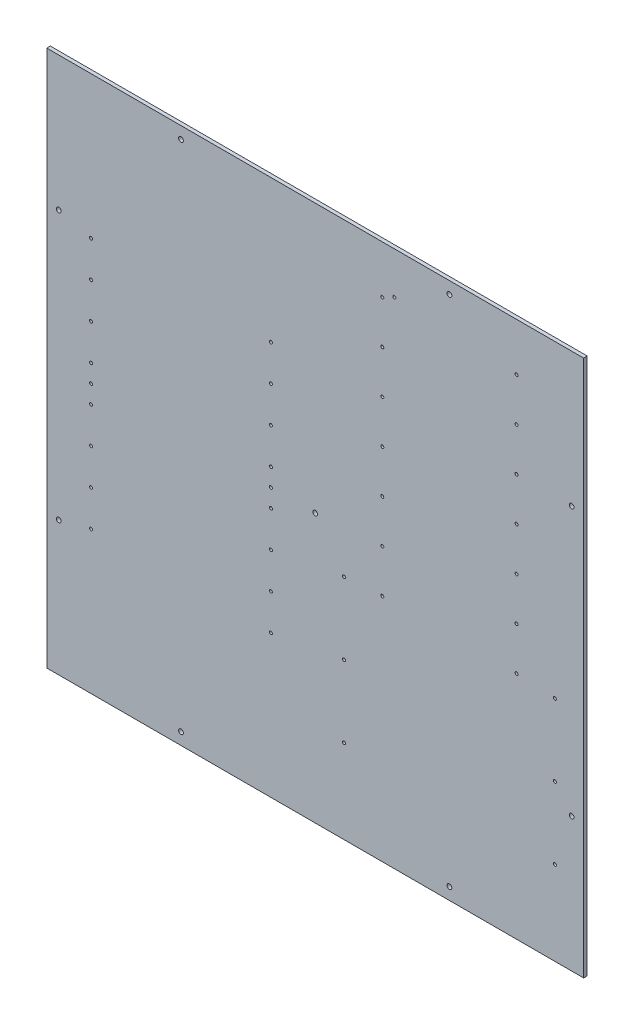
from build123d import *

# Parameters (mm, degrees)
SCHIZZO1_W                   = 448
SCHIZZO1_H                   = 448
SCHIZZO1_R                   = 2
SCHIZZO1_R_2                 = 1.25
ESTRUSIONE_ESTRUSIONE1_DEPTH = 3


with BuildPart() as part:
    # Schizzo1 → Estrusione-Estrusione1 (new body)
    with BuildSketch(Plane.XY):
        with Locations((224, 224)):
            Rectangle(SCHIZZO1_W, SCHIZZO1_H)
        with Locations((10, 336)):
            Circle(SCHIZZO1_R, mode=Mode.SUBTRACT)
        with Locations((336, 438)):
            Circle(SCHIZZO1_R, mode=Mode.SUBTRACT)
        with Locations((438, 336)):
            Circle(SCHIZZO1_R, mode=Mode.SUBTRACT)
        with Locations((438, 112)):
            Circle(SCHIZZO1_R, mode=Mode.SUBTRACT)
        with Locations((336, 10)):
            Circle(SCHIZZO1_R, mode=Mode.SUBTRACT)
        with Locations((112, 10)):
            Circle(SCHIZZO1_R, mode=Mode.SUBTRACT)
        with Locations((10, 112)):
            Circle(SCHIZZO1_R, mode=Mode.SUBTRACT)
        with Locations((36.958788995, 224)):
            Circle(SCHIZZO1_R_2, mode=Mode.SUBTRACT)
        with Locations((112, 438)):
            Circle(SCHIZZO1_R, mode=Mode.SUBTRACT)
        with Locations((36.958788995, 239)):
            Circle(SCHIZZO1_R_2, mode=Mode.SUBTRACT)
        with Locations((36.958788995, 269)):
            Circle(SCHIZZO1_R_2, mode=Mode.SUBTRACT)
        with Locations((36.958788995, 299)):
            Circle(SCHIZZO1_R_2, mode=Mode.SUBTRACT)
        with Locations((36.958788995, 329)):
            Circle(SCHIZZO1_R_2, mode=Mode.SUBTRACT)
        with Locations((248, 70)):
            Circle(SCHIZZO1_R_2, mode=Mode.SUBTRACT)
        with Locations((248, 130)):
            Circle(SCHIZZO1_R_2, mode=Mode.SUBTRACT)
        with Locations((424, 130)):
            Circle(SCHIZZO1_R_2, mode=Mode.SUBTRACT)
        with Locations((424, 70)):
            Circle(SCHIZZO1_R_2, mode=Mode.SUBTRACT)
        with Locations((290, 413)):
            Circle(SCHIZZO1_R_2, mode=Mode.SUBTRACT)
        with Locations((280, 408)):
            Circle(SCHIZZO1_R_2, mode=Mode.SUBTRACT)
        with Locations((392, 408)):
            Circle(SCHIZZO1_R_2, mode=Mode.SUBTRACT)
        with Locations((280, 372)):
            Circle(SCHIZZO1_R_2, mode=Mode.SUBTRACT)
        with Locations((392, 372)):
            Circle(SCHIZZO1_R_2, mode=Mode.SUBTRACT)
        with Locations((280, 336)):
            Circle(SCHIZZO1_R_2, mode=Mode.SUBTRACT)
        with Locations((392, 336)):
            Circle(SCHIZZO1_R_2, mode=Mode.SUBTRACT)
        with Locations((280, 300)):
            Circle(SCHIZZO1_R_2, mode=Mode.SUBTRACT)
        with Locations((392, 300)):
            Circle(SCHIZZO1_R_2, mode=Mode.SUBTRACT)
        with Locations((280, 264)):
            Circle(SCHIZZO1_R_2, mode=Mode.SUBTRACT)
        with Locations((392, 264)):
            Circle(SCHIZZO1_R_2, mode=Mode.SUBTRACT)
        with Locations((280, 228)):
            Circle(SCHIZZO1_R_2, mode=Mode.SUBTRACT)
        with Locations((392, 228)):
            Circle(SCHIZZO1_R_2, mode=Mode.SUBTRACT)
        with Locations((280, 192)):
            Circle(SCHIZZO1_R_2, mode=Mode.SUBTRACT)
        with Locations((392, 192)):
            Circle(SCHIZZO1_R_2, mode=Mode.SUBTRACT)
        with Locations((36.958788995, 119)):
            Circle(SCHIZZO1_R_2, mode=Mode.SUBTRACT)
        with Locations((36.958788995, 149)):
            Circle(SCHIZZO1_R_2, mode=Mode.SUBTRACT)
        with Locations((36.958788995, 179)):
            Circle(SCHIZZO1_R_2, mode=Mode.SUBTRACT)
        with Locations((36.958788995, 209)):
            Circle(SCHIZZO1_R_2, mode=Mode.SUBTRACT)
        with Locations((187.041211005, 209)):
            Circle(SCHIZZO1_R_2, mode=Mode.SUBTRACT)
        with Locations((187.041211005, 179)):
            Circle(SCHIZZO1_R_2, mode=Mode.SUBTRACT)
        with Locations((187.041211005, 149)):
            Circle(SCHIZZO1_R_2, mode=Mode.SUBTRACT)
        with Locations((187.041211005, 119)):
            Circle(SCHIZZO1_R_2, mode=Mode.SUBTRACT)
        with Locations((187.041211005, 329)):
            Circle(SCHIZZO1_R_2, mode=Mode.SUBTRACT)
        with Locations((187.041211005, 299)):
            Circle(SCHIZZO1_R_2, mode=Mode.SUBTRACT)
        with Locations((187.041211005, 269)):
            Circle(SCHIZZO1_R_2, mode=Mode.SUBTRACT)
        with Locations((187.041211005, 239)):
            Circle(SCHIZZO1_R_2, mode=Mode.SUBTRACT)
        with Locations((187.041211005, 224)):
            Circle(SCHIZZO1_R_2, mode=Mode.SUBTRACT)
        with Locations((224, 224)):
            Circle(SCHIZZO1_R, mode=Mode.SUBTRACT)
        with Locations((424, 190)):
            Circle(SCHIZZO1_R_2, mode=Mode.SUBTRACT)
        with Locations((248, 190)):
            Circle(SCHIZZO1_R_2, mode=Mode.SUBTRACT)
    extrude(amount=-ESTRUSIONE_ESTRUSIONE1_DEPTH)


solid = part.part
